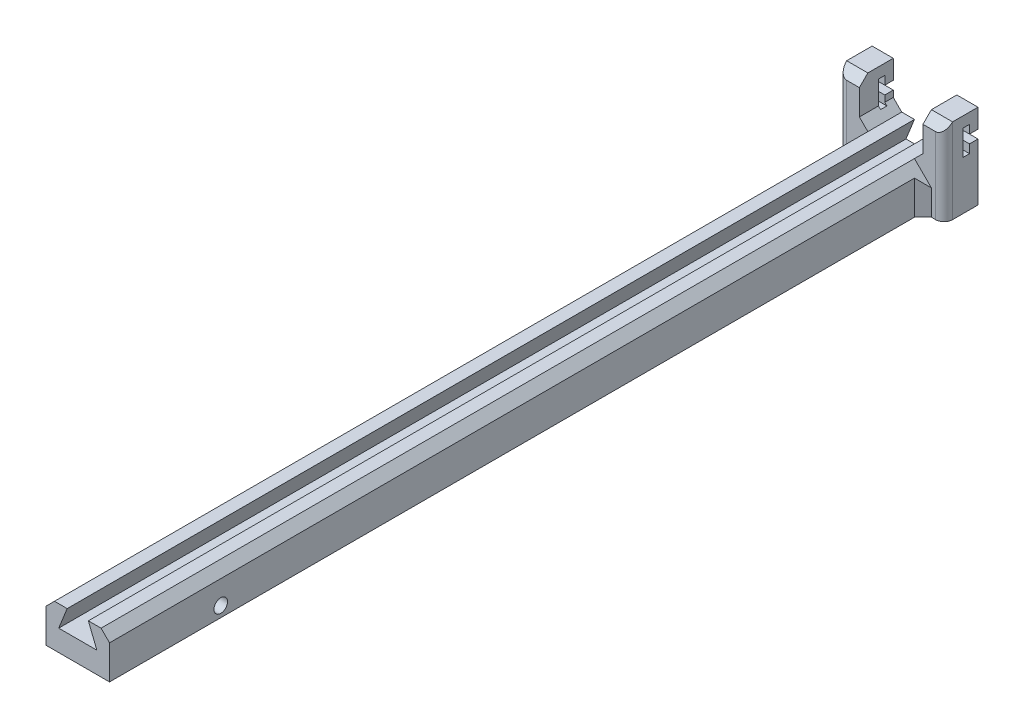
from build123d import *

# Parameters (mm, degrees)
SKETCH1_W           = 15
SKETCH1_H           = 200
BOSS_EXTRUDE1_DEPTH = 10
CUT_EXTRUDE1_DEPTH  = 210
SKETCH3_W           = 5
SKETCH3_H           = 8
BOSS_EXTRUDE2_DEPTH = 20
CUT_EXTRUDE3_DEPTH  = 40
SKETCH6_W           = 5
SKETCH6_H           = 15
CUT_EXTRUDE4_DEPTH  = 40
SKETCH7_R           = 1.6
CUT_EXTRUDE5_DEPTH  = 24
CHAMFER1_SIZE       = 2
CHAMFER2_SIZE       = 2
CHAMFER3_SIZE       = 2
CHAMFER4_SIZE       = 2
FILLET1_R           = 2


with BuildPart() as part:
    # Sketch1 → Boss-Extrude1 (new body)
    with BuildSketch(Plane(origin=(0, 0, 0), x_dir=(1, 0, 0), z_dir=(0, 1, 0))):
        Rectangle(SKETCH1_W, SKETCH1_H)
    extrude(amount=BOSS_EXTRUDE1_DEPTH)

    # Sketch2 → Cut-Extrude1 (cut)
    with BuildSketch(Plane.XY.offset(100)):
        Polygon((-2.5, 10), (-4.5, 5), (4.5, 5), (2.5, 10), align=None)
    extrude(amount=-CUT_EXTRUDE1_DEPTH, mode=Mode.SUBTRACT)

    # Sketch3 → Boss-Extrude2 (add)
    with BuildSketch(Plane.XZ):
        with Locations((-10, -96)):
            Rectangle(SKETCH3_W, SKETCH3_H)
        with Locations((10, -96)):
            Rectangle(SKETCH3_W, SKETCH3_H)
    extrude(amount=-BOSS_EXTRUDE2_DEPTH)

    # Sketch4 → Cut-Extrude3 (cut)
    with BuildSketch(Plane(origin=(12.5, 0, 0), x_dir=(0, 0, -1), z_dir=(1, 0, 0))):
        Polygon((96.5, 17.5), (98, 17.5), (98, 15.5), (100, 15.5), (100, 13.5), (98, 13.5), (98, 11.5), (96.5, 11.5), align=None)
    extrude(amount=-CUT_EXTRUDE3_DEPTH, mode=Mode.SUBTRACT)

    # Sketch6 → Cut-Extrude4 (cut)
    with BuildSketch(Plane(origin=(0, 5, 0), x_dir=(1, 0, 0), z_dir=(0, 1, 0))):
        with Locations((0, -77.5)):
            Rectangle(SKETCH6_W, SKETCH6_H)
    extrude(amount=-CUT_EXTRUDE4_DEPTH, mode=Mode.SUBTRACT)

    # Sketch7 → Cut-Extrude5 (cut)
    with BuildSketch(Plane(origin=(7.5, 0, 0), x_dir=(0, 0, -1), z_dir=(1, 0, 0))):
        with Locations((-73.75, 2.5)):
            Circle(SKETCH7_R)
    extrude(amount=-CUT_EXTRUDE5_DEPTH, mode=Mode.SUBTRACT)

    # Chamfer1
    # the kernel refuses this chamfer: 2 mm, written as the material it adds along each edge
    with BuildSketch(Plane(origin=(-7.5, 10, -100), x_dir=(0.9996219169112968, -0.027495876610586487, 0), z_dir=(0, 0, 1))) as chamfer1_piece_1_section:
        Polygon((CHAMFER1_SIZE * 0.999621916911, CHAMFER1_SIZE * 0.0274958766106), (-CHAMFER1_SIZE * 0.0274958766106, CHAMFER1_SIZE * 0.999621916911), (0, 0), align=None)
    chamfer1_piece_1 = extrude(amount=8, mode=Mode.PRIVATE)
    chamfer1_piece_1 = split(chamfer1_piece_1, bisect_by=Plane(origin=(-6.8, 11.5, -99), z_dir=(0, -1, 0)), keep=Keep.TOP, mode=Mode.PRIVATE)
    add(chamfer1_piece_1)
    with BuildSketch(Plane(origin=(-7.5, 10, -100), x_dir=(0.9996219169112968, -0.027495876610586487, 0), z_dir=(0, 0, 1))) as chamfer1_piece_2_section:
        Polygon((CHAMFER1_SIZE * 0.999621916911, CHAMFER1_SIZE * 0.0274958766106), (-CHAMFER1_SIZE * 0.0274958766106, CHAMFER1_SIZE * 0.999621916911), (0, 0), align=None)
    chamfer1_piece_2 = extrude(amount=13.143365976, mode=Mode.PRIVATE)
    chamfer1_piece_2 = split(chamfer1_piece_2, bisect_by=Plane(origin=(-7.333333333, 11.666666667, -98), z_dir=(0, 0, -1)), keep=Keep.TOP, mode=Mode.PRIVATE)
    add(chamfer1_piece_2)
    with BuildSketch(Plane(origin=(-7.5, 10, -105.143365976), x_dir=(0.9996219169112968, -0.027495876610586487, 0), z_dir=(0, 0, 1))) as chamfer1_piece_3_section:
        Polygon((CHAMFER1_SIZE * 0.999621916911, CHAMFER1_SIZE * 0.0274958766106), (-CHAMFER1_SIZE * 0.0274958766106, CHAMFER1_SIZE * 0.999621916911), (0, 0), align=None)
    chamfer1_piece_3 = extrude(amount=13.143365976, mode=Mode.PRIVATE)
    chamfer1_piece_3 = split(chamfer1_piece_3, bisect_by=Plane(origin=(-7.333333333, 11.666666667, -96.5), z_dir=(0, 0, 1)), keep=Keep.TOP, mode=Mode.PRIVATE)
    add(chamfer1_piece_3)
    with BuildSketch(Plane(origin=(7.5, 10, -92), x_dir=(-0.9996219169112968, -0.027495876610586487, 0), z_dir=(0, 0, -1))) as chamfer1_piece_4_section:
        Polygon((CHAMFER1_SIZE * 0.999621916911, CHAMFER1_SIZE * 0.0274958766106), (-CHAMFER1_SIZE * 0.0274958766106, CHAMFER1_SIZE * 0.999621916911), (0, 0), align=None)
    chamfer1_piece_4 = extrude(amount=8, mode=Mode.PRIVATE)
    chamfer1_piece_4 = split(chamfer1_piece_4, bisect_by=Plane(origin=(6.8, 11.5, -94.25), z_dir=(0, -1, 0)), keep=Keep.TOP, mode=Mode.PRIVATE)
    add(chamfer1_piece_4)
    with BuildSketch(Plane(origin=(7.5, 10, -92), x_dir=(-0.9996219169112968, -0.027495876610586487, 0), z_dir=(0, 0, -1))) as chamfer1_piece_5_section:
        Polygon((CHAMFER1_SIZE * 0.999621916911, CHAMFER1_SIZE * 0.0274958766106), (-CHAMFER1_SIZE * 0.0274958766106, CHAMFER1_SIZE * 0.999621916911), (0, 0), align=None)
    chamfer1_piece_5 = extrude(amount=13.143365976, mode=Mode.PRIVATE)
    chamfer1_piece_5 = split(chamfer1_piece_5, bisect_by=Plane(origin=(7.333333333, 11.666666667, -96.5), z_dir=(0, 0, 1)), keep=Keep.TOP, mode=Mode.PRIVATE)
    add(chamfer1_piece_5)
    with BuildSketch(Plane(origin=(7.5, 10, -86.856634024), x_dir=(-0.9996219169112968, -0.027495876610586487, 0), z_dir=(0, 0, -1))) as chamfer1_piece_6_section:
        Polygon((CHAMFER1_SIZE * 0.999621916911, CHAMFER1_SIZE * 0.0274958766106), (-CHAMFER1_SIZE * 0.0274958766106, CHAMFER1_SIZE * 0.999621916911), (0, 0), align=None)
    chamfer1_piece_6 = extrude(amount=13.143365976, mode=Mode.PRIVATE)
    chamfer1_piece_6 = split(chamfer1_piece_6, bisect_by=Plane(origin=(7.333333333, 11.666666667, -98), z_dir=(0, 0, -1)), keep=Keep.TOP, mode=Mode.PRIVATE)
    add(chamfer1_piece_6)

    # Chamfer2
    chamfer2_edges = [part.edges().sort_by_distance(p)[0] for p in [
        (7.5, 10, 4),
        (-7.5, 10, 4),
    ]]
    chamfer(chamfer2_edges, length=CHAMFER2_SIZE)

    # Chamfer3
    chamfer3_edges = [part.edges().sort_by_distance(p)[0] for p in [
        (7.5, 4, -92),
        (-7.5, 4, -92),
    ]]
    chamfer(chamfer3_edges, length=CHAMFER3_SIZE)

    # Chamfer4
    chamfer4_edges = [part.edges().sort_by_distance(p)[0] for p in [
        (-10, 20, -92),
        (10, 20, -92),
    ]]
    chamfer(chamfer4_edges, length=CHAMFER4_SIZE)

    # Fillet1
    fillet1_edges = [part.edges().sort_by_distance(p)[0] for p in [
        (12.5, 9, -92),
        (-12.5, 9, -92),
    ]]
    fillet(fillet1_edges, radius=FILLET1_R)


solid = part.part
